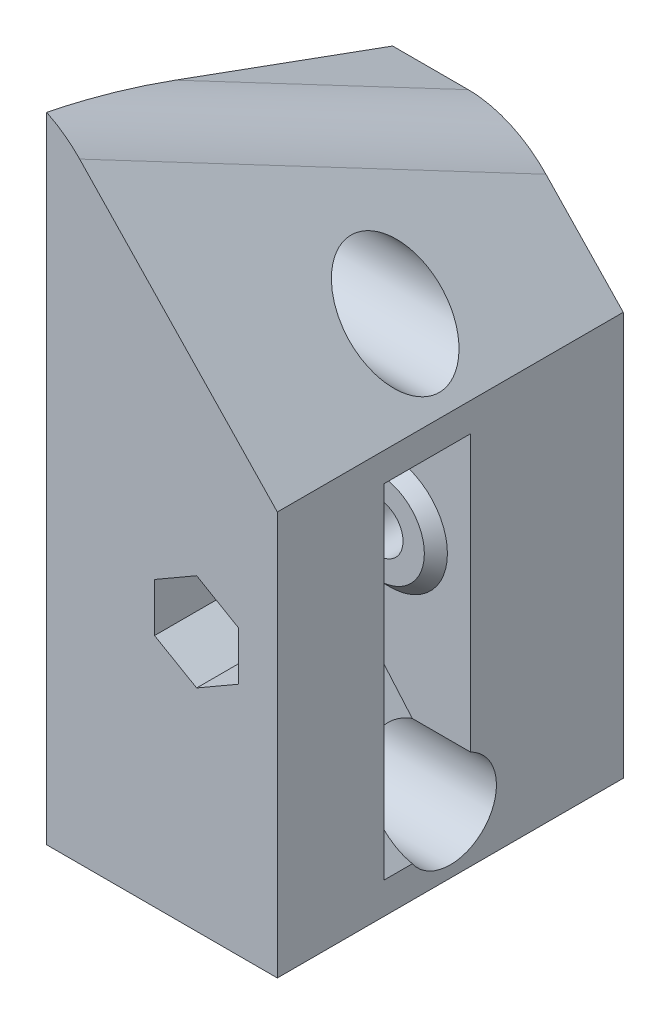
from build123d import *

# Parameters (mm, degrees)
BOSS_EXTRUDE1_DEPTH = 22.5
CUT_EXTRUDE1_DEPTH  = 3.75
SKETCH3_R           = 2.15
CUT_EXTRUDE2_DEPTH  = 43.5
CUT_EXTRUDE3_DEPTH  = 7
SKETCH5_R           = 4
CUT_EXTRUDE4_DEPTH  = 8
CHAMFER4_START      = -3.75
CHAMFER4_DEPTH      = 7.5
SKETCH7_R           = 2.25
CUT_EXTRUDE5_DEPTH  = 35.922915113
CUT_EXTRUDE6_START  = -7
SKETCH8_R           = 4
CUT_EXTRUDE6_DEPTH  = 28.922915113
BOSS_EXTRUDE2_DEPTH = 20
CUT_EXTRUDE7_DEPTH  = 50.161333531
FILLET1_R           = 8
BOSS_EXTRUDE3_START = 1
SKETCH11_R          = 5
SKETCH11_R_2        = 2.15
BOSS_EXTRUDE3_DEPTH = 1
CHAMFER5_SIZE       = 1


with BuildPart() as part:
    # Sketch1 → Boss-Extrude1 (new, symmetric)
    with BuildSketch(Plane(origin=(0, 0, 0), x_dir=(1, 0, 0), z_dir=(0, 1, 0))):
        Polygon((0, -2), (0, -13), (20, -13), (20, 17), (0, 17), (0, 6), (-0.6, 6), (-0.6, -2), align=None)
    extrude(amount=BOSS_EXTRUDE1_DEPTH, both=True)

    # Sketch2 → Cut-Extrude1 (cut, symmetric)
    with BuildSketch(Plane.XY):
        with BuildLine():
            Line((13, 10), (20, 10))
            ThreePointArc((20, 10), (30, 0), (20, -10))
            Line((20, -10), (13, -10))
            ThreePointArc((13, -10), (3, 0), (13, 10))
        make_face()
    extrude(amount=CUT_EXTRUDE1_DEPTH, both=True, mode=Mode.SUBTRACT)

    # Sketch3 → Cut-Extrude2 (cut, through all)
    with BuildSketch(Plane(origin=(0, 0, -17), x_dir=(-1, 0, 0), z_dir=(0, 0, -1))):
        with Locations((-13, 0)):
            Circle(SKETCH3_R)
    extrude(amount=-CUT_EXTRUDE2_DEPTH, mode=Mode.SUBTRACT)

    # Sketch4 → Cut-Extrude3 (cut)
    with BuildSketch(Plane.XY.offset(13)):
        Polygon((13, -4.214656965), (16.65, -2.107328483), (16.65, 2.107328483), (13, 4.214656965), (9.35, 2.107328483), (9.35, -2.107328483), align=None)
    extrude(amount=-CUT_EXTRUDE3_DEPTH, mode=Mode.SUBTRACT)

    # Sketch5 → Cut-Extrude4 (cut)
    with BuildSketch(Plane(origin=(0, 0, -17), x_dir=(-1, 0, 0), z_dir=(0, 0, -1))):
        with Locations((-13, 0)):
            Circle(SKETCH5_R)
    extrude(amount=-CUT_EXTRUDE4_DEPTH, mode=Mode.SUBTRACT)

    # Chamfer4: read off the stored shape, not the designer's step
    # Chamfer4 outline → Chamfer4 (cut)
    with BuildSketch(Plane.XY.offset(CHAMFER4_START)):
        with BuildLine():
            ThreePointArc((13, -10), (12.247869581, -9.971674876), (11.5, -9.886859967))
            Line((11.5, -9.886859967), (20, -19.773719933))
            Line((20, -19.773719933), (20, -10))
            Line((20, -10), (13, -10))
        make_face()
    extrude(amount=CHAMFER4_DEPTH, mode=Mode.SUBTRACT)

    # Sketch7 → Cut-Extrude5 (cut, through all)
    with BuildSketch(Plane.ZY.offset(0.6)):
        with Locations((-2, 17.5)):
            Circle(SKETCH7_R)
        with Locations((-2, -17.5)):
            Circle(SKETCH7_R)
    extrude(amount=-CUT_EXTRUDE5_DEPTH, mode=Mode.SUBTRACT)

    # Sketch8 → Cut-Extrude6 (cut, through all)
    with BuildSketch(Plane.ZY.offset(0.6).offset(CUT_EXTRUDE6_START)):
        with Locations((-2, 17.5)):
            Circle(SKETCH8_R)
        with Locations((-2, -17.5)):
            Circle(SKETCH8_R)
    extrude(amount=-CUT_EXTRUDE6_DEPTH, mode=Mode.SUBTRACT)

    # Sketch9 → Boss-Extrude2 (add)
    with BuildSketch(Plane(origin=(20, 0, 0), x_dir=(0, 0, -1), z_dir=(1, 0, 0))):
        Polygon((17, 22.5), (-13, 22.5), (-13, 33.419107028), align=None)
    extrude(amount=-BOSS_EXTRUDE2_DEPTH)

    # Sketch10 → Cut-Extrude7 (cut, through all)
    with BuildSketch(Plane(origin=(0, 0, -17), x_dir=(-1, 0, 0), z_dir=(0, 0, -1))):
        Polygon((-20, 12.5), (-20, 33.419107028), (0, 33.419107028), align=None)
    extrude(amount=-CUT_EXTRUDE7_DEPTH, mode=Mode.SUBTRACT)

    # Fillet1
    fillet1_edges = [part.edges().sort_by_distance(p)[0] for p in [
        (5.219681229, 27.959553514, -2),
    ]]
    fillet(fillet1_edges, radius=FILLET1_R)

    # Sketch11 → Boss-Extrude3 (add)
    with BuildSketch(Plane(origin=(0, 0, 3.75), x_dir=(-1, 0, 0), z_dir=(0, 0, -1)).offset(BOSS_EXTRUDE3_START)):
        with Locations(Location((-13, 0, 0), (0, 0, 180))):
            Circle(SKETCH11_R)
        with Locations((-13, 0)):
            Circle(SKETCH11_R_2, mode=Mode.SUBTRACT)
    boss_extrude3 = extrude(amount=-BOSS_EXTRUDE3_DEPTH)

    # Mirror1: Boss-Extrude3 across plane
    add(boss_extrude3.mirror(Plane(origin=(0, 0, 0), x_dir=(1, 0, 0), z_dir=(0, 0, -1))))

    # Chamfer5
    chamfer5_edges = [part.edges().sort_by_distance(p)[0] for p in [
        (8, 0, 2.75),
        (8, 0, -2.75),
    ]]
    chamfer(chamfer5_edges, length=CHAMFER5_SIZE - 0.0001)  # a hair under: the kernel refuses the full size


solid = part.part
